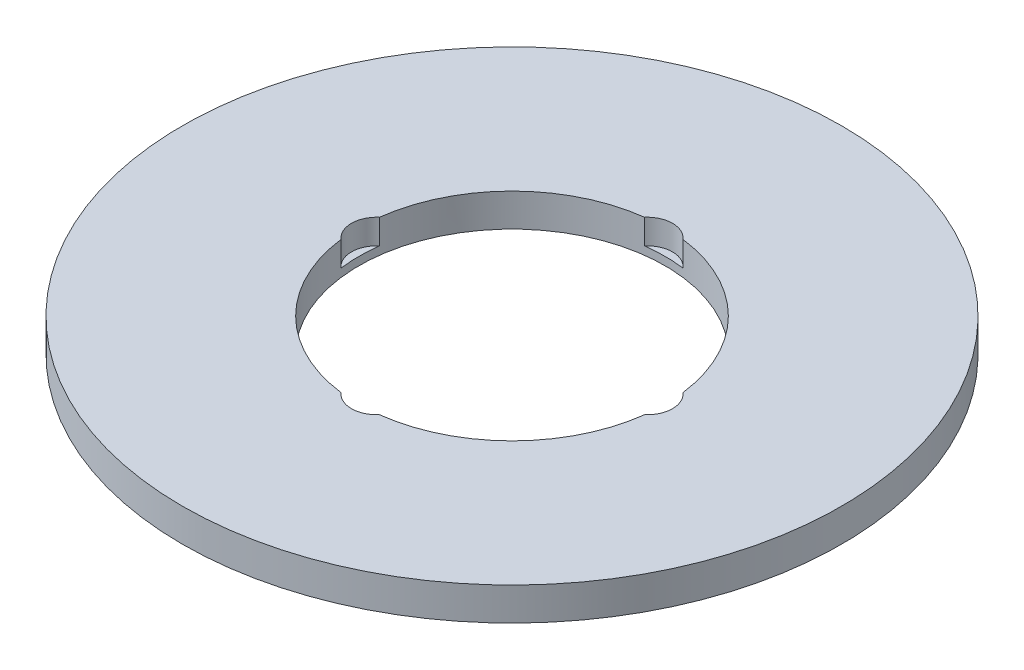
from build123d import *

# Parameters (mm, degrees)
SKETCH1_R           = 70
BOSS_EXTRUDE1_DEPTH = 7
SKETCH2_R           = 32.5
CUT_EXTRUDE1_DEPTH  = 100.242128151
SKETCH3_R           = 5.396472421
CUT_EXTRUDE2_DEPTH  = 5.268711771
CIRPATTERN1_COUNT   = 4


with BuildPart() as part:
    # Sketch1 → Boss-Extrude1 (new body)
    with BuildSketch(Plane(origin=(0, 0, 0), x_dir=(1, 0, 0), z_dir=(0, 1, 0))):
        Circle(SKETCH1_R)
    extrude(amount=BOSS_EXTRUDE1_DEPTH)

    # Sketch2 → Cut-Extrude1 (cut, through all)
    with BuildSketch(Plane(origin=(0, 0, 0), x_dir=(1, 0, 0), z_dir=(0, 1, 0))):
        Circle(SKETCH2_R)
    extrude(amount=CUT_EXTRUDE1_DEPTH, mode=Mode.SUBTRACT)

    # Sketch3 → Cut-Extrude2 (cut)
    with BuildSketch(Plane(origin=(0, 7, 0), x_dir=(1, 0, 0), z_dir=(0, 1, 0))):
        with Locations((-28.706374574, 0)):
            Circle(SKETCH3_R)
    cut_extrude2 = extrude(amount=-CUT_EXTRUDE2_DEPTH, mode=Mode.SUBTRACT)

    # CirPattern1: Cut-Extrude2 ×4 about axis
    cirpattern1_axis = Axis((0, 0, 0), (0, 1, 0))
    for i in range(1, CIRPATTERN1_COUNT):
        add(cut_extrude2.rotate(cirpattern1_axis, i * 360 / CIRPATTERN1_COUNT), mode=Mode.SUBTRACT)


solid = part.part
